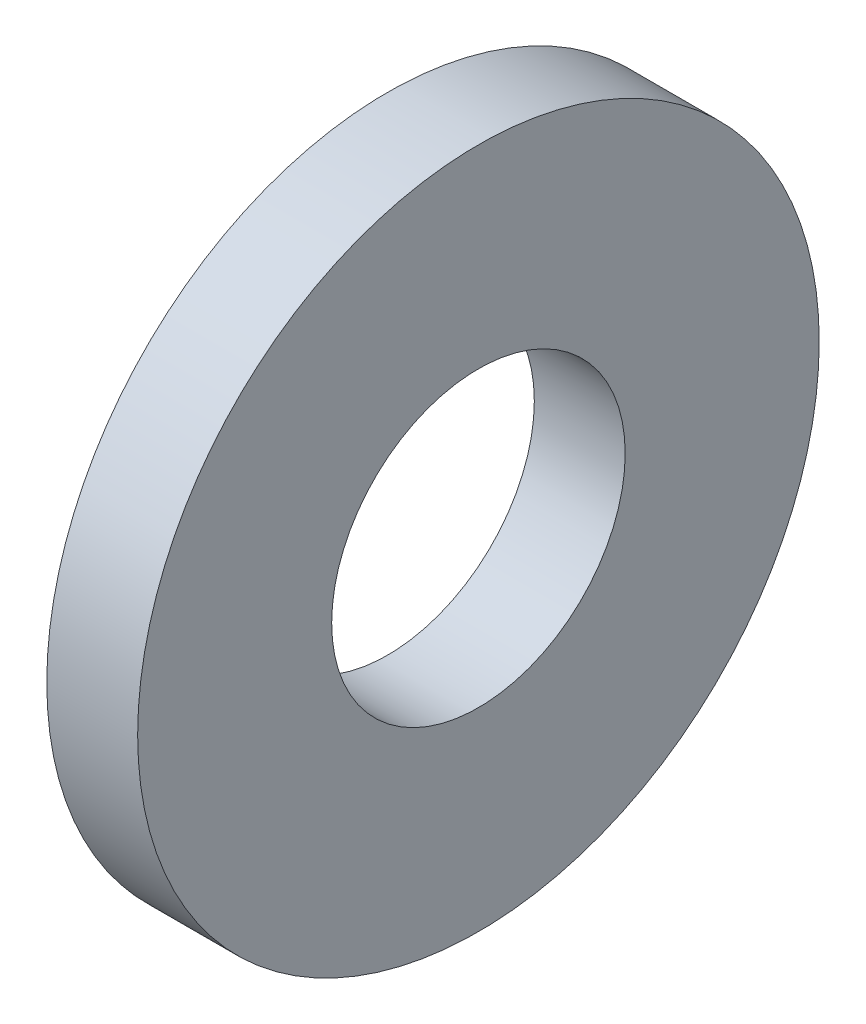
from build123d import *

# Parameters (mm, degrees)
SKETCH1_R           = 9.525
SKETCH1_R_2         = 4.1021
BOSS_EXTRUDE1_DEPTH = 2.54


with BuildPart() as part:
    # Sketch1 → Boss-Extrude1 (new body)
    with BuildSketch(Plane(origin=(0, 0, 0), x_dir=(0, 0, -1), z_dir=(1, 0, 0))):
        Circle(SKETCH1_R)
        Circle(SKETCH1_R_2, mode=Mode.SUBTRACT)
    extrude(amount=BOSS_EXTRUDE1_DEPTH)


solid = part.part
